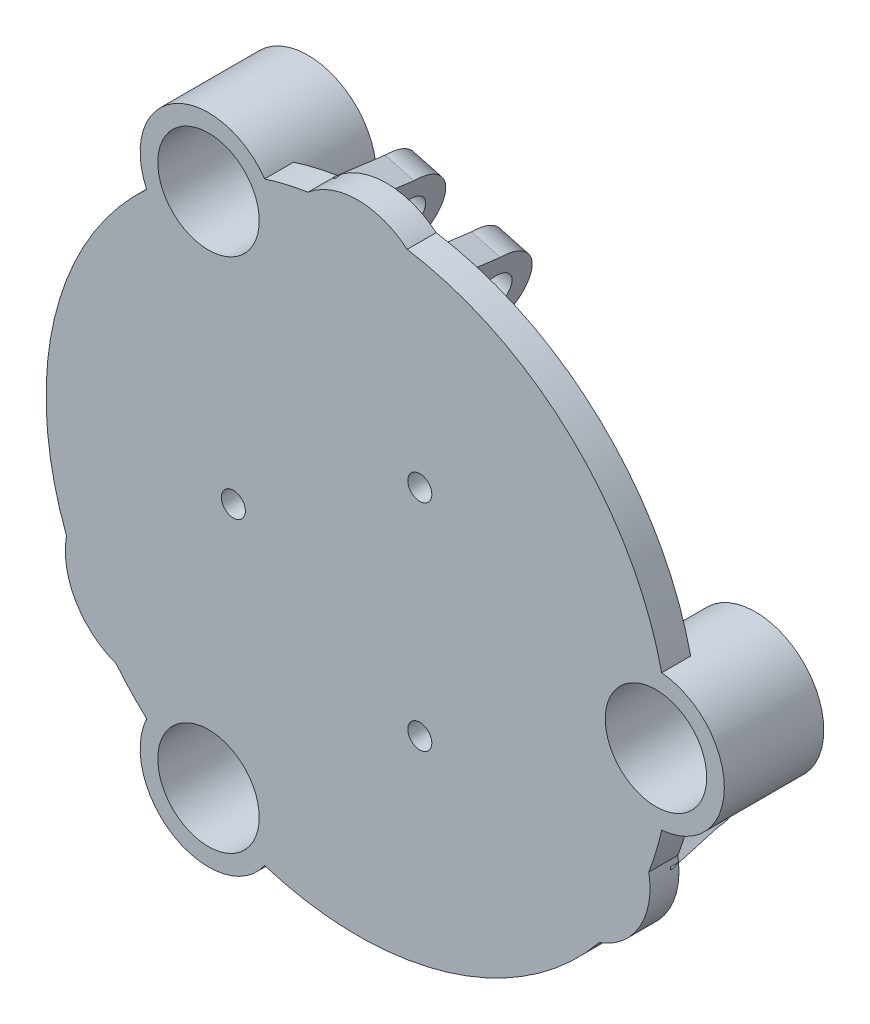
from build123d import *

# Parameters (mm, degrees)
F_01_START                              = 33.5
S01_JOINING_CENTRE_OF_FLOATING_Y_R      = 9
F_01_JOINING_CENTRE_OF_FLOATING_Y_DEPTH = 3.5
F_02_START                              = 33.5
F_02_FLOATING_SPOKE_1_DEPTH             = 3.5
F_03_START                              = 33.5
F_03_FLOATING_SPOKE_2_DEPTH             = 3.5
F_04_START                              = 33.5
F_04_FLOATING_SPOKE_3_DEPTH             = 3.5
F_05_START                              = 33.5
F_05_MOVING_TENDON_TIE_WEB_1_DEPTH      = 3.5
F_06_START                              = 29.8
S06_TENDON_ANCHOR_BASE_1_R              = 4.2
F_06_TENDON_ANCHOR_BASE_1_DEPTH         = 3.7
F_07_START                              = 28
S07_TENDON_MOUTH_1_R                    = 3.15
F_07_TENDON_MOUTH_1_DEPTH               = 1.8
F_08_START                              = 33.5
F_08_MOVING_TENDON_TIE_WEB_2_DEPTH      = 3.5
F_09_START                              = 29.8
S09_TENDON_ANCHOR_BASE_2_R              = 4.2
F_09_TENDON_ANCHOR_BASE_2_DEPTH         = 3.7
F_10_START                              = 28
S10_TENDON_MOUTH_2_R                    = 3.15
F_10_TENDON_MOUTH_2_DEPTH               = 1.8
F_11_START                              = 33.5
F_11_MOVING_TENDON_TIE_WEB_3_DEPTH      = 3.5
F_12_START                              = 29.8
S12_TENDON_ANCHOR_BASE_3_R              = 4.2
F_12_TENDON_ANCHOR_BASE_3_DEPTH         = 3.7
F_13_START                              = 28
S13_TENDON_MOUTH_3_R                    = 3.15
F_13_TENDON_MOUTH_3_DEPTH               = 1.8
F_14_START                              = 33.5
S14_JOINED_DRIVE_HOOP_R                 = 37.6
F_14_JOINED_DRIVE_HOOP_DEPTH            = 3.5
F_15_START                              = 25
S15_SLIDING_GUIDE_BARREL_1_R            = 8.25
F_15_SLIDING_GUIDE_BARREL_1_DEPTH       = 12
F_16_START                              = 25
S16_SLIDING_GUIDE_BARREL_2_R            = 8.25
F_16_SLIDING_GUIDE_BARREL_2_DEPTH       = 12
F_17_START                              = 25
S17_SLIDING_GUIDE_BARREL_3_R            = 8.25
F_17_SLIDING_GUIDE_BARREL_3_DEPTH       = 12
F_18_START                              = 24
S18_GUIDE_BUSHING_SEATS_R               = 6.12
F_18_GUIDE_BUSHING_SEATS_DEPTH          = 14
F_19_START                              = 27.8
S19_THROUGH_TENDON_TIE_EYES_R           = 1.45
F_19_THROUGH_TENDON_TIE_EYES_DEPTH      = 10
F_20_START                              = -7.2
F_20_INTEGRAL_B1_FORK_CHEEK_L_DEPTH     = 3.6
F_21_START                              = 3.6
F_21_INTEGRAL_B1_FORK_CHEEK_R_DEPTH     = 3.6
F_22_START                              = -7.5
S22_B1_PIVOT_THROUGH_BOTH_CHEEKS_R      = 1.65
F_22_B1_PIVOT_THROUGH_BOTH_CHEEKS_DEPTH = 15
F_23_START                              = -7.3
S23_B1_RECESSED_PIVOT_SCREW_HEAD_R      = 2.7
F_23_B1_RECESSED_PIVOT_SCREW_HEAD_DEPTH = 1.5
F_24_START                              = -7.2
F_24_INTEGRAL_B2_FORK_CHEEK_L_DEPTH     = 3.6
F_25_START                              = 3.6
F_25_INTEGRAL_B2_FORK_CHEEK_R_DEPTH     = 3.6
F_26_START                              = -7.5
S26_B2_PIVOT_THROUGH_BOTH_CHEEKS_R      = 2.6
F_26_B2_PIVOT_THROUGH_BOTH_CHEEKS_DEPTH = 15
F_27_START                              = -7.3
S27_B2_RECESSED_PIVOT_SCREW_HEAD_R      = 2.7
F_27_B2_RECESSED_PIVOT_SCREW_HEAD_DEPTH = 1.5
F_28_START                              = -7.2
F_28_INTEGRAL_B3_FORK_CHEEK_L_DEPTH     = 3.6
F_29_START                              = 3.6
F_29_INTEGRAL_B3_FORK_CHEEK_R_DEPTH     = 3.6
F_30_START                              = -7.5
S30_B3_PIVOT_THROUGH_BOTH_CHEEKS_R      = 2.6
F_30_B3_PIVOT_THROUGH_BOTH_CHEEKS_DEPTH = 15
F_31_START                              = -7.3
S31_B3_RECESSED_PIVOT_SCREW_HEAD_R      = 2.7
F_31_B3_RECESSED_PIVOT_SCREW_HEAD_DEPTH = 1.5
CUT_EXTRUDE1_DEPTH                      = 71.085181941
CUT_EXTRUDE1_DEPTH_BACK                 = 16
SKETCH1_R                               = 2.6


with BuildPart() as part:
    # S01 - Joining centre of floating Y → 01 - Joining centre of floating Y (new body)
    with BuildSketch(Plane.XY.offset(F_01_START)):
        Circle(S01_JOINING_CENTRE_OF_FLOATING_Y_R)
    extrude(amount=F_01_JOINING_CENTRE_OF_FLOATING_Y_DEPTH)

    # S02 - Floating spoke 1 → 02 - Floating spoke 1 (add)
    with BuildSketch(Plane.XY.offset(F_02_START)):
        with BuildLine():
            Line((4.65, -8.054036255), (-21.330762114, -23.054036255))
            ThreePointArc((-21.330762114, -23.054036255), (-34.034798369, -19.65), (-30.630762114, -6.945963745))
            Line((-30.630762114, -6.945963745), (-4.65, 8.054036255))
            ThreePointArc((-4.65, 8.054036255), (8.054036255, 4.65), (4.65, -8.054036255))
        make_face()
    extrude(amount=F_02_FLOATING_SPOKE_1_DEPTH)

    # S03 - Floating spoke 2 → 03 - Floating spoke 2 (add)
    with BuildSketch(Plane.XY.offset(F_03_START)):
        with BuildLine():
            Line((4.65, 8.054036255), (30.630762114, -6.945963745))
            ThreePointArc((30.630762114, -6.945963745), (34.034798369, -19.65), (21.330762114, -23.054036255))
            Line((21.330762114, -23.054036255), (-4.65, -8.054036255))
            ThreePointArc((-4.65, -8.054036255), (-8.054036255, 4.65), (4.65, 8.054036255))
        make_face()
    extrude(amount=F_03_FLOATING_SPOKE_2_DEPTH)

    # S04 - Floating spoke 3 → 04 - Floating spoke 3 (add)
    with BuildSketch(Plane.XY.offset(F_04_START)):
        with BuildLine():
            Line((-9.3, 0), (-9.3, 30))
            ThreePointArc((-9.3, 30), (0, 39.3), (9.3, 30))
            Line((9.3, 30), (9.3, 0))
            ThreePointArc((9.3, 0), (0, -9.3), (-9.3, 0))
        make_face()
    extrude(amount=F_04_FLOATING_SPOKE_3_DEPTH)

    # S05 - Moving tendon tie web 1 → 05 - Moving tendon tie web 1 (add)
    with BuildSketch(Plane.XY.offset(F_05_START)):
        with BuildLine():
            Line((25.299707774, -21.263079513), (6.818945661, -19.25346057))
            ThreePointArc((6.818945661, -19.25346057), (1.236920487, -12.309326717), (8.181054339, -6.727301544))
            Line((8.181054339, -6.727301544), (26.661816453, -8.736920487))
            ThreePointArc((26.661816453, -8.736920487), (32.243841627, -15.681054339), (25.299707774, -21.263079513))
        make_face()
    extrude(amount=F_05_MOVING_TENDON_TIE_WEB_1_DEPTH)

    # S06 - Tendon anchor base 1 → 06 - Tendon anchor base 1 (add)
    with BuildSketch(Plane.XY.offset(F_06_START)):
        with Locations((7.5, -12.990381057)):
            Circle(S06_TENDON_ANCHOR_BASE_1_R)
    extrude(amount=F_06_TENDON_ANCHOR_BASE_1_DEPTH)

    # S07 - Tendon mouth 1 → 07 - Tendon mouth 1 (add)
    with BuildSketch(Plane.XY.offset(F_07_START)):
        with Locations((7.5, -12.990381057)):
            Circle(S07_TENDON_MOUTH_1_R)
    extrude(amount=F_07_TENDON_MOUTH_1_DEPTH)

    # S08 - Moving tendon tie web 2 → 08 - Moving tendon tie web 2 (add)
    with BuildSketch(Plane.XY.offset(F_08_START)):
        with BuildLine():
            Line((5.764513134, 32.541729397), (13.264513134, 15.532110454))
            ThreePointArc((13.264513134, 15.532110454), (10.041729397, 7.225867923), (1.735486866, 10.448651659))
            Line((1.735486866, 10.448651659), (-5.764513134, 27.458270603))
            ThreePointArc((-5.764513134, 27.458270603), (-2.541729397, 35.764513134), (5.764513134, 32.541729397))
        make_face()
    extrude(amount=F_08_MOVING_TENDON_TIE_WEB_2_DEPTH)

    # S09 - Tendon anchor base 2 → 09 - Tendon anchor base 2 (add)
    with BuildSketch(Plane.XY.offset(F_09_START)):
        with Locations((7.5, 12.990381057)):
            Circle(S09_TENDON_ANCHOR_BASE_2_R)
    extrude(amount=F_09_TENDON_ANCHOR_BASE_2_DEPTH)

    # S10 - Tendon mouth 2 → 10 - Tendon mouth 2 (add)
    with BuildSketch(Plane.XY.offset(F_10_START)):
        with Locations((7.5, 12.990381057)):
            Circle(S10_TENDON_MOUTH_2_R)
    extrude(amount=F_10_TENDON_MOUTH_2_DEPTH)

    # S11 - Moving tendon tie web 3 → 11 - Moving tendon tie web 3 (add)
    with BuildSketch(Plane.XY.offset(F_11_START)):
        with BuildLine():
            Line((-31.064220908, -11.278649884), (-20.083458795, 3.721350116))
            ThreePointArc((-20.083458795, 3.721350116), (-11.278649884, 5.083458795), (-9.916541205, -3.721350116))
            Line((-9.916541205, -3.721350116), (-20.897303319, -18.721350116))
            ThreePointArc((-20.897303319, -18.721350116), (-29.702112229, -20.083458795), (-31.064220908, -11.278649884))
        make_face()
    extrude(amount=F_11_MOVING_TENDON_TIE_WEB_3_DEPTH)

    # S12 - Tendon anchor base 3 → 12 - Tendon anchor base 3 (add)
    with BuildSketch(Plane.XY.offset(F_12_START)):
        with Locations((-15, 0)):
            Circle(S12_TENDON_ANCHOR_BASE_3_R)
    extrude(amount=F_12_TENDON_ANCHOR_BASE_3_DEPTH)

    # S13 - Tendon mouth 3 → 13 - Tendon mouth 3 (add)
    with BuildSketch(Plane.XY.offset(F_13_START)):
        with Locations((-15, 0)):
            Circle(S13_TENDON_MOUTH_3_R)
    extrude(amount=F_13_TENDON_MOUTH_3_DEPTH)

    # S14 - Joined drive hoop → 14 - Joined drive hoop (add)
    with BuildSketch(Plane.XY.offset(F_14_START)):
        Circle(S14_JOINED_DRIVE_HOOP_R)
    extrude(amount=F_14_JOINED_DRIVE_HOOP_DEPTH)

    # S15 - Sliding guide barrel 1 → 15 - Sliding guide barrel 1 (add)
    with BuildSketch(Plane.XY.offset(F_15_START)):
        with Locations((36, 0)):
            Circle(S15_SLIDING_GUIDE_BARREL_1_R)
    extrude(amount=F_15_SLIDING_GUIDE_BARREL_1_DEPTH)

    # S16 - Sliding guide barrel 2 → 16 - Sliding guide barrel 2 (add)
    with BuildSketch(Plane.XY.offset(F_16_START)):
        with Locations((-18, 31.176914536)):
            Circle(S16_SLIDING_GUIDE_BARREL_2_R)
    extrude(amount=F_16_SLIDING_GUIDE_BARREL_2_DEPTH)

    # S17 - Sliding guide barrel 3 → 17 - Sliding guide barrel 3 (add)
    with BuildSketch(Plane.XY.offset(F_17_START)):
        with Locations((-18, -31.176914536)):
            Circle(S17_SLIDING_GUIDE_BARREL_3_R)
    extrude(amount=F_17_SLIDING_GUIDE_BARREL_3_DEPTH)

    # S18 - Guide bushing seats → 18 - Guide bushing seats (cut)
    with BuildSketch(Plane.XY.offset(F_18_START)):
        with Locations((36, 0)):
            Circle(S18_GUIDE_BUSHING_SEATS_R)
        with Locations((-18, 31.176914536)):
            Circle(S18_GUIDE_BUSHING_SEATS_R)
        with Locations((-18, -31.176914536)):
            Circle(S18_GUIDE_BUSHING_SEATS_R)
    extrude(amount=F_18_GUIDE_BUSHING_SEATS_DEPTH, mode=Mode.SUBTRACT)

    # S19 - Through tendon tie eyes → 19 - Through tendon tie eyes (cut)
    with BuildSketch(Plane.XY.offset(F_19_START)):
        with Locations((7.5, -12.990381057)):
            Circle(S19_THROUGH_TENDON_TIE_EYES_R)
        with Locations((7.5, 12.990381057)):
            Circle(S19_THROUGH_TENDON_TIE_EYES_R)
        with Locations((-15, 0)):
            Circle(S19_THROUGH_TENDON_TIE_EYES_R)
    extrude(amount=F_19_THROUGH_TENDON_TIE_EYES_DEPTH, mode=Mode.SUBTRACT)

    # S20 - Integral B1 fork cheek L → 20 - Integral B1 fork cheek L (add)
    with BuildSketch(Plane(origin=(2.009618943, -7.5, 0), x_dir=(0.9659258262890683, 0.2588190451025208, 0), z_dir=(-0.2588190451025208, 0.9659258262890684, 0)).offset(F_20_START)):
        with BuildLine():
            Line((-35.077774789, -34.5), (-22.877774789, -34.5))
            Line((-22.877774789, -34.5), (-24.027774789, -28))
            ThreePointArc((-24.027774789, -28), (-28.977774789, -23.05), (-33.927774789, -28))
            Line((-33.927774789, -28), (-35.077774789, -34.5))
        make_face()
    extrude(amount=F_20_INTEGRAL_B1_FORK_CHEEK_L_DEPTH)

    # S21 - Integral B1 fork cheek R → 21 - Integral B1 fork cheek R (add)
    with BuildSketch(Plane(origin=(2.009618943, -7.5, 0), x_dir=(0.9659258262890683, 0.2588190451025208, 0), z_dir=(-0.2588190451025208, 0.9659258262890684, 0)).offset(F_21_START)):
        with BuildLine():
            Line((-35.077774789, -34.5), (-22.877774789, -34.5))
            Line((-22.877774789, -34.5), (-24.027774789, -28))
            ThreePointArc((-24.027774789, -28), (-28.977774789, -23.05), (-33.927774789, -28))
            Line((-33.927774789, -28), (-35.077774789, -34.5))
        make_face()
    extrude(amount=F_21_INTEGRAL_B1_FORK_CHEEK_R_DEPTH)

    # S22 - B1 pivot through both cheeks → 22 - B1 pivot through both cheeks (cut)
    with BuildSketch(Plane(origin=(2.009618943, -7.5, 0), x_dir=(0.9659258262890683, 0.2588190451025208, 0), z_dir=(-0.2588190451025208, 0.9659258262890684, 0)).offset(F_22_START)):
        with Locations((-28.977774789, -28)):
            Circle(S22_B1_PIVOT_THROUGH_BOTH_CHEEKS_R)
    extrude(amount=F_22_B1_PIVOT_THROUGH_BOTH_CHEEKS_DEPTH, mode=Mode.SUBTRACT)

    # S23 - B1 recessed pivot screw head → 23 - B1 recessed pivot screw head (cut)
    with BuildSketch(Plane(origin=(2.009618943, -7.5, 0), x_dir=(0.9659258262890683, 0.2588190451025208, 0), z_dir=(-0.2588190451025208, 0.9659258262890684, 0)).offset(F_23_START)):
        with Locations((-28.977774789, -28)):
            Circle(S23_B1_RECESSED_PIVOT_SCREW_HEAD_R)
    extrude(amount=F_23_B1_RECESSED_PIVOT_SCREW_HEAD_DEPTH, mode=Mode.SUBTRACT)

    # S24 - Integral B2 fork cheek L → 24 - Integral B2 fork cheek L (add)
    with BuildSketch(Plane(origin=(5.490381057, 5.490381057, 0), x_dir=(0, 0, 1), z_dir=(-0.7071067811865476, -0.7071067811865475, 0)).offset(F_24_START)):
        with BuildLine():
            Line((34.5, -35.077774789), (34.5, -22.877774789))
            Line((34.5, -22.877774789), (28, -24.027774789))
            ThreePointArc((28, -24.027774789), (23.05, -28.977774789), (28, -33.927774789))
            Line((28, -33.927774789), (34.5, -35.077774789))
        make_face()
    extrude(amount=F_24_INTEGRAL_B2_FORK_CHEEK_L_DEPTH)

    # S25 - Integral B2 fork cheek R → 25 - Integral B2 fork cheek R (add)
    with BuildSketch(Plane(origin=(5.490381057, 5.490381057, 0), x_dir=(0, 0, 1), z_dir=(-0.7071067811865476, -0.7071067811865475, 0)).offset(F_25_START)):
        with BuildLine():
            Line((34.5, -35.077774789), (34.5, -22.877774789))
            Line((34.5, -22.877774789), (28, -24.027774789))
            ThreePointArc((28, -24.027774789), (23.05, -28.977774789), (28, -33.927774789))
            Line((28, -33.927774789), (34.5, -35.077774789))
        make_face()
    extrude(amount=F_25_INTEGRAL_B2_FORK_CHEEK_R_DEPTH)

    # S26 - B2 pivot through both cheeks → 26 - B2 pivot through both cheeks (cut)
    with BuildSketch(Plane(origin=(5.490381057, 5.490381057, 0), x_dir=(0, 0, 1), z_dir=(-0.7071067811865476, -0.7071067811865475, 0)).offset(F_26_START)):
        with Locations((28, -28.977774789)):
            Circle(S26_B2_PIVOT_THROUGH_BOTH_CHEEKS_R)
    extrude(amount=F_26_B2_PIVOT_THROUGH_BOTH_CHEEKS_DEPTH, mode=Mode.SUBTRACT)

    # S27 - B2 recessed pivot screw head → 27 - B2 recessed pivot screw head (cut)
    with BuildSketch(Plane(origin=(5.490381057, 5.490381057, 0), x_dir=(0, 0, 1), z_dir=(-0.7071067811865476, -0.7071067811865475, 0)).offset(F_27_START)):
        with Locations((28, -28.977774789)):
            Circle(S27_B2_RECESSED_PIVOT_SCREW_HEAD_R)
    extrude(amount=F_27_B2_RECESSED_PIVOT_SCREW_HEAD_DEPTH, mode=Mode.SUBTRACT)

    # S28 - Integral B3 fork cheek L → 28 - Integral B3 fork cheek L (add)
    with BuildSketch(Plane(origin=(-7.5, 2.009618943, 0), x_dir=(0, 0, -1), z_dir=(0.9659258262890683, -0.25881904510252113, 0)).offset(F_28_START)):
        with BuildLine():
            Line((-34.5, 35.077774789), (-34.5, 22.877774789))
            Line((-34.5, 22.877774789), (-28, 24.027774789))
            ThreePointArc((-28, 24.027774789), (-23.05, 28.977774789), (-28, 33.927774789))
            Line((-28, 33.927774789), (-34.5, 35.077774789))
        make_face()
    extrude(amount=F_28_INTEGRAL_B3_FORK_CHEEK_L_DEPTH)

    # S29 - Integral B3 fork cheek R → 29 - Integral B3 fork cheek R (add)
    with BuildSketch(Plane(origin=(-7.5, 2.009618943, 0), x_dir=(0, 0, -1), z_dir=(0.9659258262890683, -0.25881904510252113, 0)).offset(F_29_START)):
        with BuildLine():
            Line((-34.5, 35.077774789), (-34.5, 22.877774789))
            Line((-34.5, 22.877774789), (-28, 24.027774789))
            ThreePointArc((-28, 24.027774789), (-23.05, 28.977774789), (-28, 33.927774789))
            Line((-28, 33.927774789), (-34.5, 35.077774789))
        make_face()
    extrude(amount=F_29_INTEGRAL_B3_FORK_CHEEK_R_DEPTH)

    # S30 - B3 pivot through both cheeks → 30 - B3 pivot through both cheeks (cut)
    with BuildSketch(Plane(origin=(-7.5, 2.009618943, 0), x_dir=(0, 0, -1), z_dir=(0.9659258262890683, -0.25881904510252113, 0)).offset(F_30_START)):
        with Locations((-28, 28.977774789)):
            Circle(S30_B3_PIVOT_THROUGH_BOTH_CHEEKS_R)
    extrude(amount=F_30_B3_PIVOT_THROUGH_BOTH_CHEEKS_DEPTH, mode=Mode.SUBTRACT)

    # S31 - B3 recessed pivot screw head → 31 - B3 recessed pivot screw head (cut)
    with BuildSketch(Plane(origin=(-7.5, 2.009618943, 0), x_dir=(0, 0, -1), z_dir=(0.9659258262890683, -0.25881904510252113, 0)).offset(F_31_START)):
        with Locations((-28, 28.977774789)):
            Circle(S31_B3_RECESSED_PIVOT_SCREW_HEAD_R)
    extrude(amount=F_31_B3_RECESSED_PIVOT_SCREW_HEAD_DEPTH, mode=Mode.SUBTRACT)

    # Sketch1 → Cut-Extrude1 (cut, two sides: drawn at the far end of the back side and taken through both)
    with BuildSketch(Plane(origin=(0.146121818, -0.545334051, 0), x_dir=(0.9659258262890683, 0.25881904510252085, 0), z_dir=(-0.2588190451025208, 0.9659258262890682, 0)).offset(-CUT_EXTRUDE1_DEPTH_BACK)):
        with Locations((-28.977774789, -28)):
            Circle(SKETCH1_R)
    extrude(amount=CUT_EXTRUDE1_DEPTH + CUT_EXTRUDE1_DEPTH_BACK, mode=Mode.SUBTRACT)


solid = part.part
